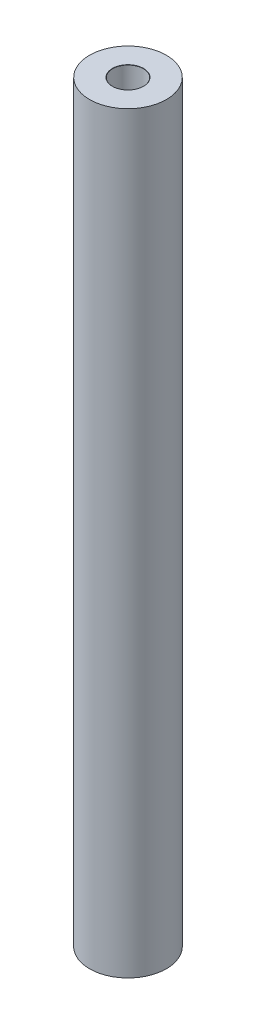
from build123d import *

# Parameters (mm, degrees)
SKETCH1_R           = 5
BOSS_EXTRUDE1_DEPTH = 98


with BuildPart() as part:
    # Sketch1 → Boss-Extrude1 (new body)
    with BuildSketch(Plane(origin=(0, 0, 0), x_dir=(1, 0, 0), z_dir=(0, 1, 0))):
        Circle(SKETCH1_R)
    extrude(amount=BOSS_EXTRUDE1_DEPTH)

    # Sketch4 → Ø4.0mm Dowel Hole1 (revolve, cut)
    with BuildSketch(Plane(origin=(0, 98, 0), x_dir=(0, 0, 1), z_dir=(1, 0, 0))):
        Polygon((0, 0), (0, 11.201721238), (2, 10), (2, 0.025), (2.025, 0), align=None)
    f_4_0mm_dowel_hole1 = revolve(axis=Axis((0, 104.35, 0), (0, -1, 0)), mode=Mode.SUBTRACT)

    # Mirror1: Ø4.0mm Dowel Hole1 across plane
    add(f_4_0mm_dowel_hole1.mirror(Plane.ZX.offset(49)), mode=Mode.SUBTRACT)


solid = part.part
